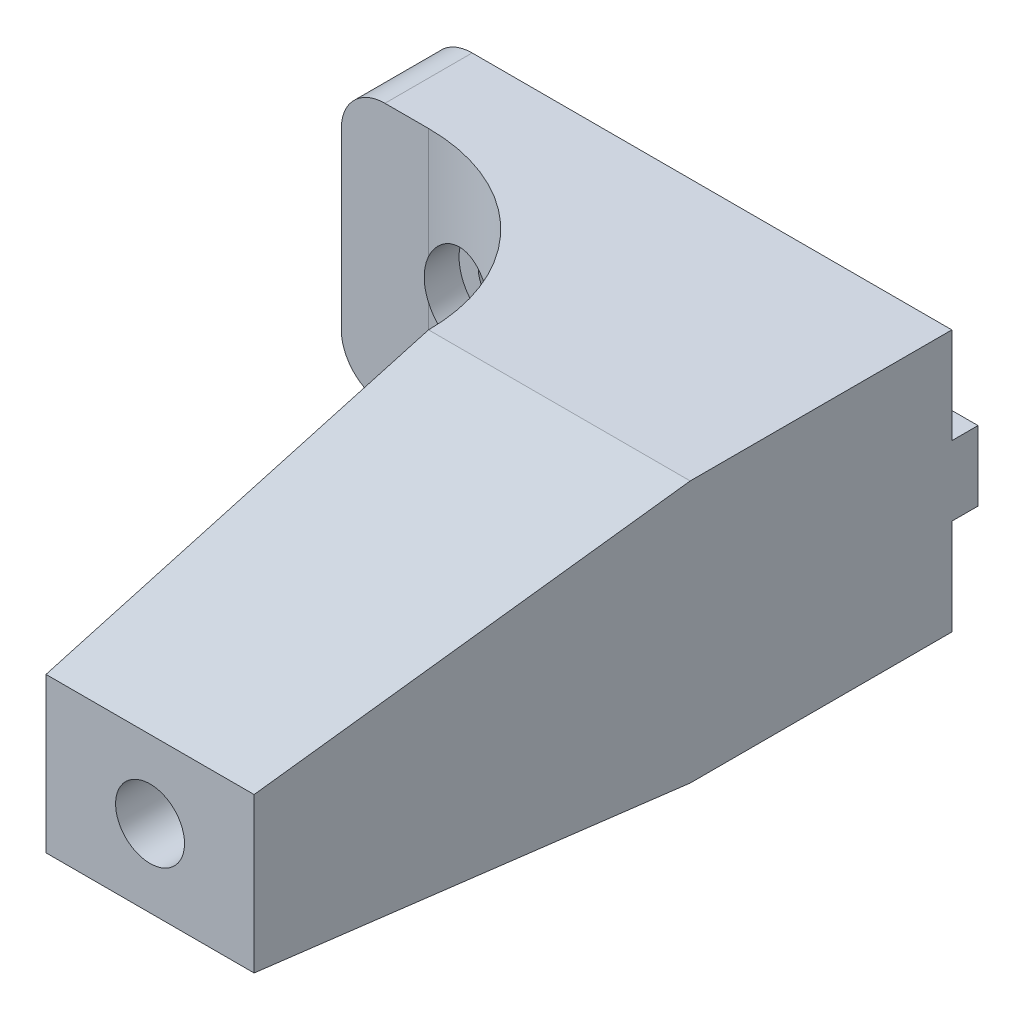
from build123d import *

# Parameters (mm, degrees)
BASE_DEPTH                    = 10
TOWER_SKETCH_W                = 29.999999999999996
TOWER_SKETCH_H                = 30
TOWER_DEPTH                   = 70
BASE_RADIUS_R                 = 20
BASE_SCREW_D                  = 6.6
BASE_SCREW_CBORE_D            = 11
BASE_SCREW_CBORE_DEPTH        = 24
TOWER_BEVEL_SIZE              = 50
TOWER_BEVEL_SIZE_2            = 6.139228045
TOP_COVER_SCREW_HOLE_SKETCH_R = 3.950000000000002
COVER_SREW_HOLE_DEPTH         = 15
P_IDAT_VYSUNUT_M3_DEPTH       = 3
PROFILE_BEVEL_SIZE            = 3
ROUNDING_R                    = 5


# Some blends are built 0.0001 mm under size
with BuildPart() as part:
    # Base sketch → Base (new body)
    with BuildSketch(Plane.XY):
        Polygon((-30.000000000000007, 15.000000000000002), (29.999999999999986, 15.000000000000002), (29.999999999999993, -14.999999999999998), (-30, -14.999999999999998), align=None)
    extrude(amount=BASE_DEPTH)

    # Tower sketch → Tower (add)
    with BuildSketch(Plane.XY.offset(10)):
        with Locations((14.999999999999988, 1.78e-15)):
            Rectangle(TOWER_SKETCH_W, TOWER_SKETCH_H)
    extrude(amount=TOWER_DEPTH)

    # Base radius
    base_radius_edges = [part.edges().sort_by_distance(p)[0] for p in [
        (-1.041e-14, 1.78e-15, 10),
    ]]
    fillet(base_radius_edges, radius=BASE_RADIUS_R)

    # Base screw (through all)
    with Locations(Plane.XY.offset(30)):
        with Locations((-15, 0)):
            CounterBoreHole(BASE_SCREW_D / 2, BASE_SCREW_CBORE_D / 2, BASE_SCREW_CBORE_DEPTH)

    # tower bevel
    # the kernel refuses this chamfer: 50, 6.139228045 mm, written as the material it takes off along each edge
    with BuildSketch(Plane(origin=(159.96415924997035, 15.000000000000002, 80), x_dir=(0, 0.004688575069790863, -0.9999890085715016), z_dir=(-1, 0, 0))) as tower_bevel_piece_1:
        Polygon((TOWER_BEVEL_SIZE * 0.999989008572, TOWER_BEVEL_SIZE * 0.00468857506979), (-TOWER_BEVEL_SIZE_2 * 0.0046885750699, TOWER_BEVEL_SIZE_2 * 0.999989008595), (0, 0), align=None)
    extrude(amount=289.9283184999407, mode=Mode.SUBTRACT)
    with BuildSketch(Plane(origin=(-1.041e-14, 144.96415924997035, 80), x_dir=(-0.00468857506979085, 0, -0.9999890085715016), z_dir=(0, -1, 0))) as tower_bevel_piece_2:
        Polygon((TOWER_BEVEL_SIZE * 0.999989008572, TOWER_BEVEL_SIZE * 0.00468857506979), (-TOWER_BEVEL_SIZE_2 * 0.0046885750699, TOWER_BEVEL_SIZE_2 * 0.999989008595), (0, 0), align=None)
    extrude(amount=289.9283184999407, mode=Mode.SUBTRACT)
    with BuildSketch(Plane(origin=(-129.96415924997035, -14.999999999999998, 80), x_dir=(0, 0.9548873060039238, 0.2969684037613576), z_dir=(1, 0, 0))) as tower_bevel_piece_3:
        Polygon((TOWER_BEVEL_SIZE_2 * 0.954887306027, -TOWER_BEVEL_SIZE_2 * 0.296968403768), (-TOWER_BEVEL_SIZE * 0.296968403761, -TOWER_BEVEL_SIZE * 0.954887306004), (0, 0), align=None)
    extrude(amount=289.9283184999407, mode=Mode.SUBTRACT)

    # Top cover screw hole sketch → Cover srew hole (cut)
    with BuildSketch(Plane.XY.offset(80)):
        with Locations((18.06961402257261, 2.6e-15)):
            Circle(TOP_COVER_SCREW_HOLE_SKETCH_R)
    extrude(amount=-COVER_SREW_HOLE_DEPTH, mode=Mode.SUBTRACT)

    # profile sketch → Přidat vysunutím3 (add)
    with BuildSketch(Plane(origin=(0, 0, 0), x_dir=(-1, 0, 0), z_dir=(0, 0, -1))):
        with BuildLine():
            Line((8.071796769724529, 4), (-30, 4))
            Line((-30, 4), (-30, -4))
            Line((-30, -4), (8.071796769724536, -4))
            ThreePointArc((8.071796769724518, -4.000000000000045), (7.000000000000002, 9.8e-16), (8.071796769724518, 4.0000000000000435))
        make_face()
        with BuildLine():
            Line((30.000000000000007, 4), (21.928203230275386, 4))
            ThreePointArc((21.928203230275436, 4.0000000000001386), (22.72740661031253, 2.070552360820243), (23.000000000000007, 0))
            ThreePointArc((23.000000000000007, -1.96e-15), (22.72740661031253, -2.0705523608202414), (21.928203230275436, -4.000000000000134))
            Line((21.928203230275393, -4), (30.000000000000007, -4))
            Line((30.000000000000007, -4), (30.000000000000007, 4))
        make_face()
    extrude(amount=P_IDAT_VYSUNUT_M3_DEPTH)

    # Profile bevel
    profile_bevel_edges = [part.edges().sort_by_distance(p)[0] for p in [
        (-23.000000000000007, 3.22e-15, -3),
    ]]
    chamfer(profile_bevel_edges, length=PROFILE_BEVEL_SIZE - 0.0001)  # a hair under: the kernel refuses the full size

    # rounding
    rounding_edges = [part.edges().sort_by_distance(p)[0] for p in [
        (-30, -14.999999999999998, 5),
        (-30.000000000000007, 15.000000000000002, 5),
    ]]
    fillet(rounding_edges, radius=ROUNDING_R)


solid = part.part
